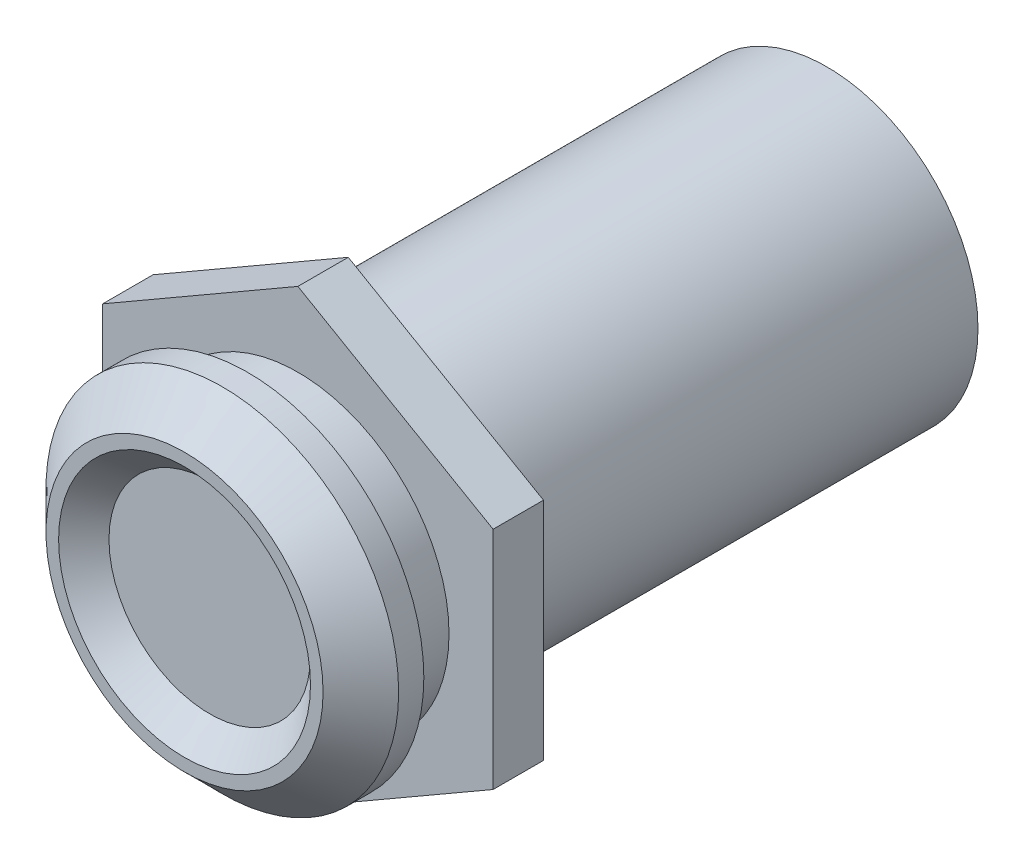
from build123d import *

# Parameters (mm, degrees)
SKETCH1_R           = 7
BOSS_EXTRUDE1_DEPTH = 1
SKETCH2_R           = 7
BOSS_EXTRUDE2_DEPTH = 1.5
BOSS_EXTRUDE2_TAPER = 45
SKETCH3_R           = 5
CUT_EXTRUDE1_DEPTH  = 1
CUT_EXTRUDE1_DRAFT  = -45
SKETCH4_R           = 6
BOSS_EXTRUDE3_DEPTH = 23
NUT_DEPTH           = 2


with BuildPart() as part:
    # Sketch1 → Boss-Extrude1 (new body)
    with BuildSketch(Plane.XY):
        Circle(SKETCH1_R)
    extrude(amount=BOSS_EXTRUDE1_DEPTH)

    # Sketch2 → Boss-Extrude2 (add)
    with BuildSketch(Plane.XY.offset(1)):
        Circle(SKETCH2_R)
    extrude(amount=BOSS_EXTRUDE2_DEPTH, taper=BOSS_EXTRUDE2_TAPER)


with BuildPart() as cut_extrude1_tool:
    # Sketch3 → Cut-Extrude1 (with draft: the straight prism first)
    with BuildSketch(Plane.XY.offset(2.5)):
        Circle(SKETCH3_R)
    extrude(amount=-CUT_EXTRUDE1_DEPTH)
    # Cut-Extrude1: the draft: its side faces are tilted about the plane it starts from
    cut_extrude1_sides = [cut_extrude1_tool.faces().sort_by_distance(p)[0] for p in [
        (-5, 0, 2),
    ]]
    draft(cut_extrude1_sides, Plane.XY.offset(2.5), CUT_EXTRUDE1_DRAFT)


with BuildPart() as part_1:
    add(part.part)

    # Cut-Extrude1: cut by cut_extrude1_tool
    add(cut_extrude1_tool.part, mode=Mode.SUBTRACT)

    # Sketch4 → Boss-Extrude3 (add)
    with BuildSketch(Plane.XY):
        Circle(SKETCH4_R)
    extrude(amount=-BOSS_EXTRUDE3_DEPTH)

    # Sketch5 → Nut (add)
    with BuildSketch(Plane.XY.offset(-2)):
        Polygon((0, 8.948929172), (-7.75, 4.474464586), (-7.75, -4.474464586), (0, -8.948929172), (7.75, -4.474464586), (7.75, 4.474464586), align=None)
    extrude(amount=-NUT_DEPTH)


solid = part_1.part
